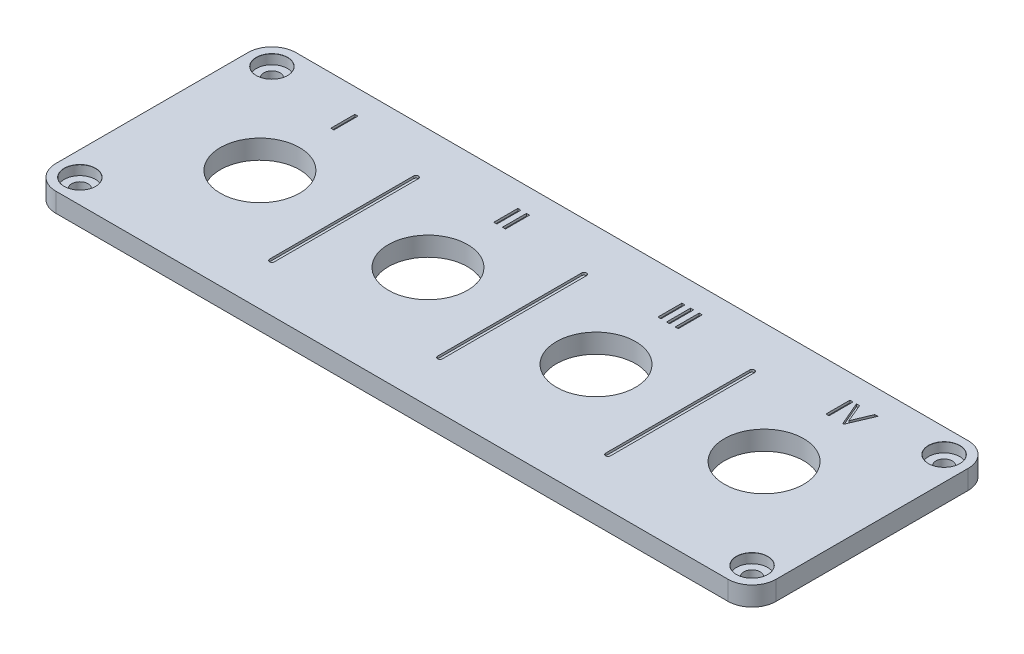
from build123d import *

# Parameters (mm, degrees)
SKETCH1_W              = 150
SKETCH1_H              = 50
BODY_DEPTH             = 4
EDGE_FILLETS_R         = 5
GX16_HOLE_D            = 16.5
GX16_PATTERN_COUNT     = 4
GX16_PATTERN_PITCH     = 35
DESIGN_CUTOUT_SKETCH_W = 0.641025641
DESIGN_CUTOUT_SKETCH_H = 5
DESIGN_CUTOUT_DEPTH    = 0.5


# Read off the part's stored shape, not the designer's step: mounting_holes
with BuildPart() as part:
    # Sketch1 → body (new body)
    with BuildSketch(Plane(origin=(0, 0, 0), x_dir=(1, 0, 0), z_dir=(0, 1, 0))):
        Rectangle(SKETCH1_W, SKETCH1_H)
    extrude(amount=BODY_DEPTH)

    # mounting_holes outline → mounting_holes (revolve, cut)
    with BuildSketch(Plane(origin=(70, 0, 20), x_dir=(1, 0, 0), z_dir=(0, 0, 1))):
        Polygon((0, 0), (1.7, 0), (1.7, 2), (3.25, 2), (3.25, 3.975), (3.275, 4), (0, 4), align=None)
    revolve(axis=Axis((70, 0, 20), (0, 1, 0)), mode=Mode.SUBTRACT)

    # mounting_holes 2 outline → mounting_holes 2 (revolve, cut)
    with BuildSketch(Plane(origin=(-70, 0, -20), x_dir=(1, 0, 0), z_dir=(0, 0, 1))):
        Polygon((0, 4), (0, 0), (1.7, 0), (1.7, 2), (3.25, 2), (3.25, 3.975), (3.275, 4), align=None)
    revolve(axis=Axis((-70, 0, -20), (0, 1, 0)), mode=Mode.SUBTRACT)

    # mounting_holes 3 outline → mounting_holes 3 (revolve, cut)
    with BuildSketch(Plane(origin=(70, 0, -20), x_dir=(1, 0, 0), z_dir=(0, 0, 1))):
        Polygon((0, 4), (0, 0), (1.7, 0), (1.7, 2), (3.25, 2), (3.25, 3.975), (3.275, 4), align=None)
    revolve(axis=Axis((70, 0, -20), (0, 1, 0)), mode=Mode.SUBTRACT)

    # mounting_holes 4 outline → mounting_holes 4 (revolve, cut)
    with BuildSketch(Plane(origin=(-70, 0, 20), x_dir=(1, 0, 0), z_dir=(0, 0, 1))):
        Polygon((0, 4), (0, 0), (1.7, 0), (1.7, 2), (3.25, 2), (3.25, 3.975), (3.275, 4), align=None)
    revolve(axis=Axis((-70, 0, 20), (0, 1, 0)), mode=Mode.SUBTRACT)

    # edge_fillets
    edge_fillets_edges = [part.edges().sort_by_distance(p)[0] for p in [
        (75, 2, 25),
        (-75, 2, 25),
        (-75, 2, -25),
        (75, 2, -25),
    ]]
    fillet(edge_fillets_edges, radius=EDGE_FILLETS_R)

    # gx16_hole (through all)
    with Locations(Plane(origin=(0, 4, 0), x_dir=(1, 0, 0), z_dir=(0, 1, 0))):
        with Locations((-52.5, 0)):
            gx16_hole = Hole(GX16_HOLE_D / 2)

    # gx16_pattern: gx16_hole ×4
    with Locations(*[(i * GX16_PATTERN_PITCH, 0, 0) for i in range(1, GX16_PATTERN_COUNT)]):
        add(gx16_hole, mode=Mode.SUBTRACT)

    # design_cutout_sketch → design_cutout (cut)
    with BuildSketch(Plane(origin=(0, 4, 0), x_dir=(1, 0, 0), z_dir=(0, 1, 0))):
        with BuildLine():
            Line((-34.5, 15), (-34.5, -15))
            ThreePointArc((-34.5, -15), (-35, -15.5), (-35.5, -15))
            Line((-35.5, -15), (-35.5, 15))
            ThreePointArc((-35.5, 15), (-35, 15.5), (-34.5, 15))
        make_face()
        with BuildLine():
            Line((0.5, 15), (0.5, -15))
            ThreePointArc((0.5, -15), (0, -15.5), (-0.5, -15))
            Line((-0.5, -15), (-0.5, 15))
            ThreePointArc((-0.5, 15), (0, 15.5), (0.5, 15))
        make_face()
        with BuildLine():
            Line((35.5, 15), (35.5, -15))
            ThreePointArc((35.5, -15), (35, -15.5), (34.5, -15))
            Line((34.5, -15), (34.5, 15))
            ThreePointArc((34.5, 15), (35, 15.5), (35.5, 15))
        make_face()
        with Locations((-52.403846154, 17.5)):
            Rectangle(DESIGN_CUTOUT_SKETCH_W, DESIGN_CUTOUT_SKETCH_H)
        with Locations((-18.46923077, 17.5)):
            Rectangle(DESIGN_CUTOUT_SKETCH_W, DESIGN_CUTOUT_SKETCH_H)
        with Locations((-16.674358975, 17.5)):
            Rectangle(DESIGN_CUTOUT_SKETCH_W, DESIGN_CUTOUT_SKETCH_H)
        with Locations((15.711538462, 17.5)):
            Rectangle(DESIGN_CUTOUT_SKETCH_W, DESIGN_CUTOUT_SKETCH_H)
        with Locations((17.506410257, 17.5)):
            Rectangle(DESIGN_CUTOUT_SKETCH_W, DESIGN_CUTOUT_SKETCH_H)
        with Locations((19.301282052, 17.5)):
            Rectangle(DESIGN_CUTOUT_SKETCH_W, DESIGN_CUTOUT_SKETCH_H)
        with Locations((50.711538462, 17.5)):
            Rectangle(DESIGN_CUTOUT_SKETCH_W, DESIGN_CUTOUT_SKETCH_H)
        Polygon((51.737179487, 20), (52.382211538, 20), (53.976762821, 16.166866987), (55.571314103, 20), (56.224358974, 20), (54.079927885, 15), (53.874599359, 15), align=None)
    extrude(amount=-DESIGN_CUTOUT_DEPTH, mode=Mode.SUBTRACT)


solid = part.part
